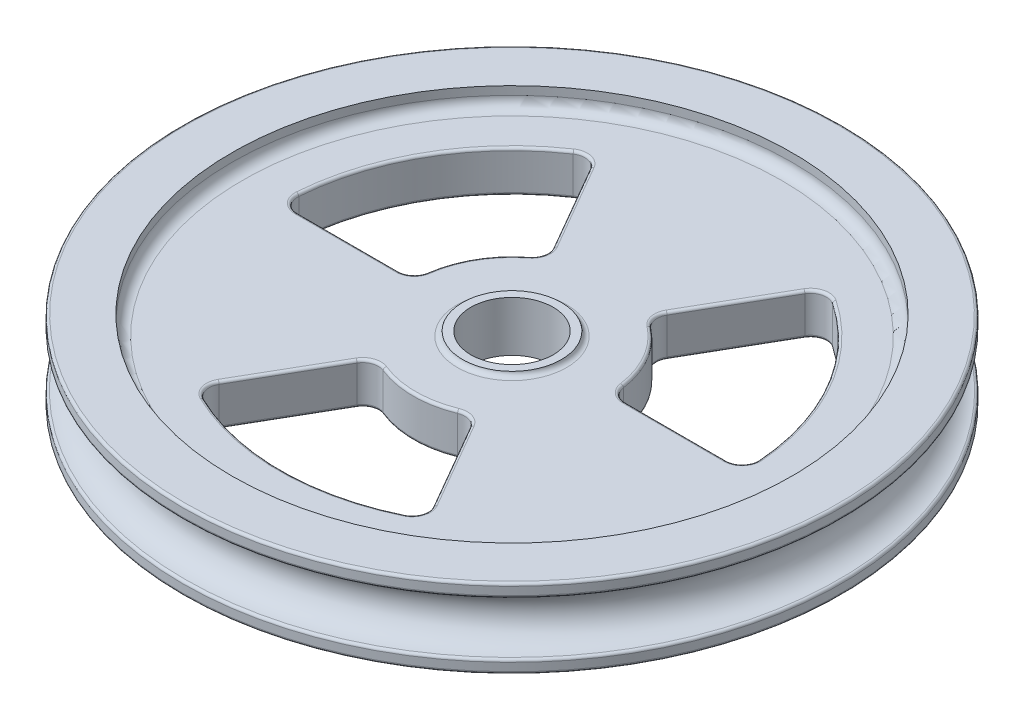
from build123d import *

# Parameters (mm, degrees)
HOLE1_D                   = 170
HOLE1_DEPTH               = 5.715
HOLE2_D                   = 170
HOLE2_DEPTH               = 5.715
CUT_EXTRUDE1_DEPTH        = 143.598531637
CUT_EXTRUDE2_DEPTH        = 143.598531637
CUT_EXTRUDE3_DEPTH        = 143.598531637
SKETCH9_W                 = 15
SKETCH9_H                 = 5.715
SKETCH10_W                = 15
SKETCH10_H                = 6.539353837
M18_CLEARANCE_HOLE1_D     = 25
M18_CLEARANCE_HOLE1_DEPTH = 19.62
M18_CLEARANCE_HOLE1_TIP   = 7.510757738
FILLET1_R                 = 4.7625
FILLET2_R                 = 0.79375
FILLET3_R                 = 1.5875
FILLET4_R                 = 3.175


with BuildPart() as part:
    # Sketch1 → Revolve1 (revolve)
    with BuildSketch(Plane.XY, mode=Mode.PRIVATE) as revolve1_sk:
        with BuildLine():
            Line((100, 12), (0, 12))
            Line((0, 12), (0, -12))
            Line((0, -12), (100, -12))
            Line((100, -12), (100, -8))
            ThreePointArc((100, -8), (92, 0), (100, 8))
            Line((100, 8), (100, 12))
        make_face()
    revolve(revolve1_sk.sketch.rotate(Axis((0, 12, 0), (0, -1, 0)), 270), axis=Axis((0, 12, 0), (0, -1, 0)))

    # Hole1
    with Locations(Plane(origin=(0, -12, 0), x_dir=(-1, 0, 0), z_dir=(0, -1, 0))):
        with Locations((0, 0)):
            Hole(HOLE1_D / 2, depth=HOLE1_DEPTH)

    # Hole2
    with Locations(Plane(origin=(0, 12, 0), x_dir=(1, 0, 0), z_dir=(0, 1, 0))):
        with Locations((0, 0)):
            Hole(HOLE2_D / 2, depth=HOLE2_DEPTH)

    # Sketch6 → Cut-Extrude1 (cut, through all)
    with BuildSketch(Plane.XZ.offset(6.285)):
        with BuildLine():
            Line((-35, -60.621778265), (-15, -25.980762114))
            ThreePointArc((-15, -25.980762114), (-25.980762114, -15), (-30, 0))
            Line((-30, 0), (-70, 0))
            ThreePointArc((-70, 0), (-60.621778265, -35), (-35, -60.621778265))
        make_face()
    extrude(amount=-CUT_EXTRUDE1_DEPTH, mode=Mode.SUBTRACT)

    # Sketch7 → Cut-Extrude2 (cut, through all)
    with BuildSketch(Plane.XZ.offset(6.285)):
        with BuildLine():
            Line((-35, 60.621778265), (-15, 25.980762114))
            ThreePointArc((-15, 25.980762114), (0, 30), (15, 25.980762114))
            Line((15, 25.980762114), (35, 60.621778265))
            ThreePointArc((35, 60.621778265), (0, 70), (-35, 60.621778265))
        make_face()
    extrude(amount=-CUT_EXTRUDE2_DEPTH, mode=Mode.SUBTRACT)

    # Sketch8 → Cut-Extrude3 (cut, through all)
    with BuildSketch(Plane(origin=(0, 6.285, 0), x_dir=(-1, 0, 0), z_dir=(0, 1, 0))):
        with BuildLine():
            Line((-35, -60.621778265), (-15, -25.980762114))
            ThreePointArc((-15, -25.980762114), (-25.980762114, -15), (-30, 0))
            Line((-30, 0), (-70, 0))
            ThreePointArc((-70, 0), (-60.621778265, -35), (-35, -60.621778265))
        make_face()
    extrude(amount=-CUT_EXTRUDE3_DEPTH, mode=Mode.SUBTRACT)

    # Sketch9 → Revolve2 (revolve)
    with BuildSketch(Plane.XY, mode=Mode.PRIVATE) as revolve2_sk:
        with Locations((7.5, 4.7625)):
            Rectangle(SKETCH9_W, SKETCH9_H)
    revolve(revolve2_sk.sketch.rotate(Axis((0, 7.62, 0), (0, -1, 0)), 270), axis=Axis((0, 7.62, 0), (0, -1, 0)))

    # Sketch10 → Revolve3 (revolve)
    with BuildSketch(Plane(origin=(0, 0, 0), x_dir=(-1, 0, 0), z_dir=(0, 0, -1)), mode=Mode.PRIVATE) as revolve3_sk:
        with Locations((-7.5, -4.350323082)):
            Rectangle(SKETCH10_W, SKETCH10_H)
    revolve(revolve3_sk.sketch.rotate(Axis((0, -7.62, 0), (0, 1, 0)), 270), axis=Axis((0, -7.62, 0), (0, 1, 0)))

    # M18 Clearance Hole1
    with Locations(Plane(origin=(0, -7.62, 0), x_dir=(-1, 0, 0), z_dir=(0, -1, 0))):
        with Locations((0, 0)):
            Hole(M18_CLEARANCE_HOLE1_D / 2, depth=M18_CLEARANCE_HOLE1_DEPTH)
            with Locations((0, 0, -(M18_CLEARANCE_HOLE1_DEPTH + M18_CLEARANCE_HOLE1_TIP / 2))):  # 118° drill point
                Cone(0, M18_CLEARANCE_HOLE1_D / 2, M18_CLEARANCE_HOLE1_TIP, mode=Mode.SUBTRACT)

    # Fillet1
    fillet1_edges = [part.edges().sort_by_distance(p)[0] for p in [
        (-35, 0, -60.621778265),
        (-70, 0, 0),
        (-30, 0, 0),
        (-15, 0, -25.980762114),
        (-35, 0, 60.621778265),
        (35, 0, 60.621778265),
        (15, 0, 25.980762114),
        (-15, 0, 25.980762114),
        (35, 0, -60.621778265),
        (70, 0, 0),
        (30, 0, 0),
        (15, 0, -25.980762114),
    ]]
    fillet(fillet1_edges, radius=FILLET1_R)

    # Fillet2
    fillet2_edges = [part.edges().sort_by_distance(p)[0] for p in [
        (-24.87453786, -6.285, 43.083963388),
        (-24.87453786, 6.285, 43.083963388),
        (0, -6.285, 70),
        (0, 6.285, 70),
        (24.87453786, -6.285, 43.083963388),
        (24.87453786, 6.285, 43.083963388),
        (0, -6.285, 30),
        (0, 6.285, 30),
        (25.980762114, 6.285, -15),
        (25.980762114, -6.285, -15),
        (24.87453786, 6.285, -43.083963388),
        (24.87453786, -6.285, -43.083963388),
        (-49.749075719, -6.285, 0),
        (-49.749075719, 6.285, 0),
        (60.621778265, 6.285, -35),
        (60.621778265, -6.285, -35),
        (49.749075719, 6.285, 0),
        (49.749075719, -6.285, 0),
        (-25.980762114, -6.285, -15),
        (-25.980762114, 6.285, -15),
        (-35.592384032, -6.285, -58.607508261),
        (-35.592384032, 6.285, -58.607508261),
        (-32.959398991, -6.285, 60.127662883),
        (-32.959398991, 6.285, 60.127662883),
        (14.638494198, -6.285, 27.697863351),
        (14.638494198, 6.285, 27.697863351),
        (16.667806194, 6.285, -26.526239524),
        (16.667806194, -6.285, -26.526239524),
        (-68.551783023, -6.285, -1.520154622),
        (-68.551783023, 6.285, -1.520154622),
        (35.592384032, 6.285, -58.607508261),
        (35.592384032, -6.285, -58.607508261),
        (-14.638494198, -6.285, 27.697863351),
        (-14.638494198, 6.285, 27.697863351),
        (68.551783023, 6.285, -1.520154622),
        (68.551783023, -6.285, -1.520154622),
        (32.959398991, -6.285, 60.127662883),
        (32.959398991, 6.285, 60.127662883),
        (-16.667806194, -6.285, -26.526239524),
        (-16.667806194, 6.285, -26.526239524),
        (-31.306300392, -6.285, -1.171623827),
        (-31.306300392, 6.285, -1.171623827),
        (31.306300392, 6.285, -1.171623827),
        (31.306300392, -6.285, -1.171623827),
        (0, 12, 100),
        (0, -12, 100),
        (0, -8, 100),
        (0, 8, 100),
        (-24.87453786, -6.285, -43.083963388),
        (-24.87453786, 6.285, -43.083963388),
        (-60.621778265, -6.285, -35),
        (-60.621778265, 6.285, -35),
    ]]
    fillet(fillet2_edges, radius=FILLET2_R)

    # Fillet3
    # the kernel refuses this fillet: 1.5875 mm, written as the material it adds along each edge
    with BuildSketch(Plane(origin=(0, 6.285, 0), x_dir=(0, 0, -1), z_dir=(1, 0, 0))) as fillet3_piece_1:
        with BuildLine():
            CenterArc((16.567290656, 1.5875), FILLET3_R, 189.152056164, 80.847943836)
            Line((15, 1.335), (14.968654187, 1.32995))
            ThreePointArc((14.968654187, 1.32995), (14.96825, 0.6675), (14.96825, 0))
            Line((14.96825, 0), (15, -0.03175))
            Line((15, -0.03175), (16.567290656, -0.03175))
            Line((16.567290656, -0.03175), (16.567290656, 0))
        make_face()
    revolve(axis=Axis((0, 6.285, 0), (0, 1, 0)))
    with BuildSketch(Plane(origin=(0, -6.285, 0), x_dir=(0, 0, 1), z_dir=(1, 0, 0))) as fillet3_piece_2:
        with BuildLine():
            CenterArc((16.567290656, 1.5875), FILLET3_R, 189.152056164, 80.847943836)
            Line((15, 1.335), (14.968654187, 1.32995))
            ThreePointArc((14.968654187, 1.32995), (14.96825, 0.6675), (14.96825, 0))
            Line((14.96825, 0), (15, -0.03175))
            Line((15, -0.03175), (16.567290656, -0.03175))
            Line((16.567290656, -0.03175), (16.567290656, 0))
        make_face()
    revolve(axis=Axis((0, -6.285, 0), (0, -1, 0)))

    # Fillet4
    fillet4_edges = [part.edges().sort_by_distance(p)[0] for p in [
        (-85, -6.285, 0),
        (85, 6.285, 0),
    ]]
    fillet(fillet4_edges, radius=FILLET4_R)


solid = part.part
